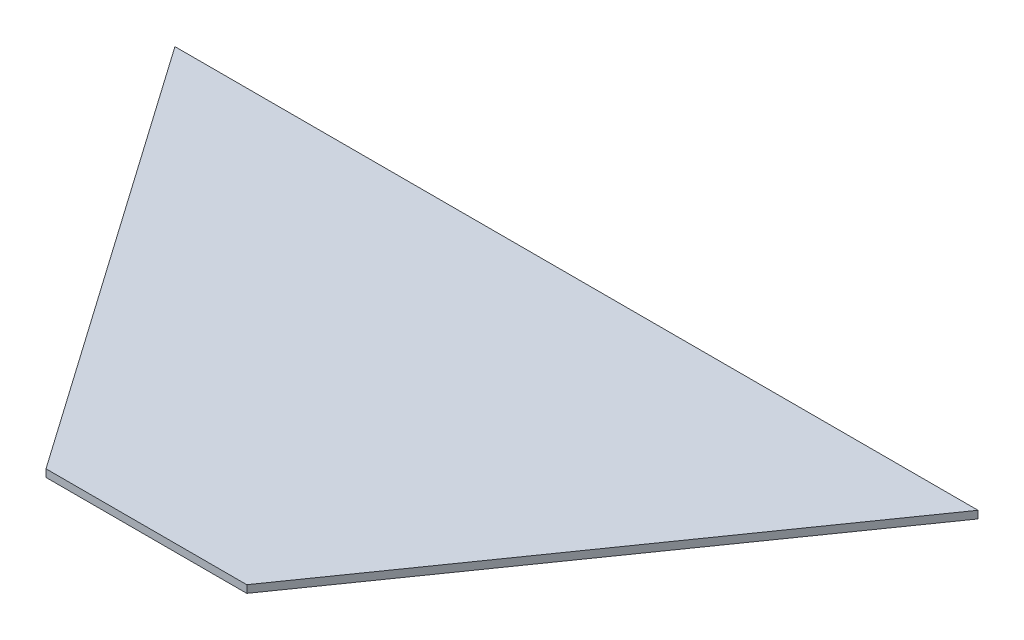
from build123d import *

# Parameters (mm, degrees)
BOSS_EXTRUDE1_DEPTH = 1.5


with BuildPart() as part:
    # Sketch1 → Boss-Extrude1 (new body)
    with BuildSketch(Plane(origin=(0, 0, 0), x_dir=(1, 0, 0), z_dir=(0, 1, 0))):
        Polygon((-80, 85.688880405), (-20, 0), (20, 0), (80, 85.688880405), align=None)
    extrude(amount=BOSS_EXTRUDE1_DEPTH)


solid = part.part
